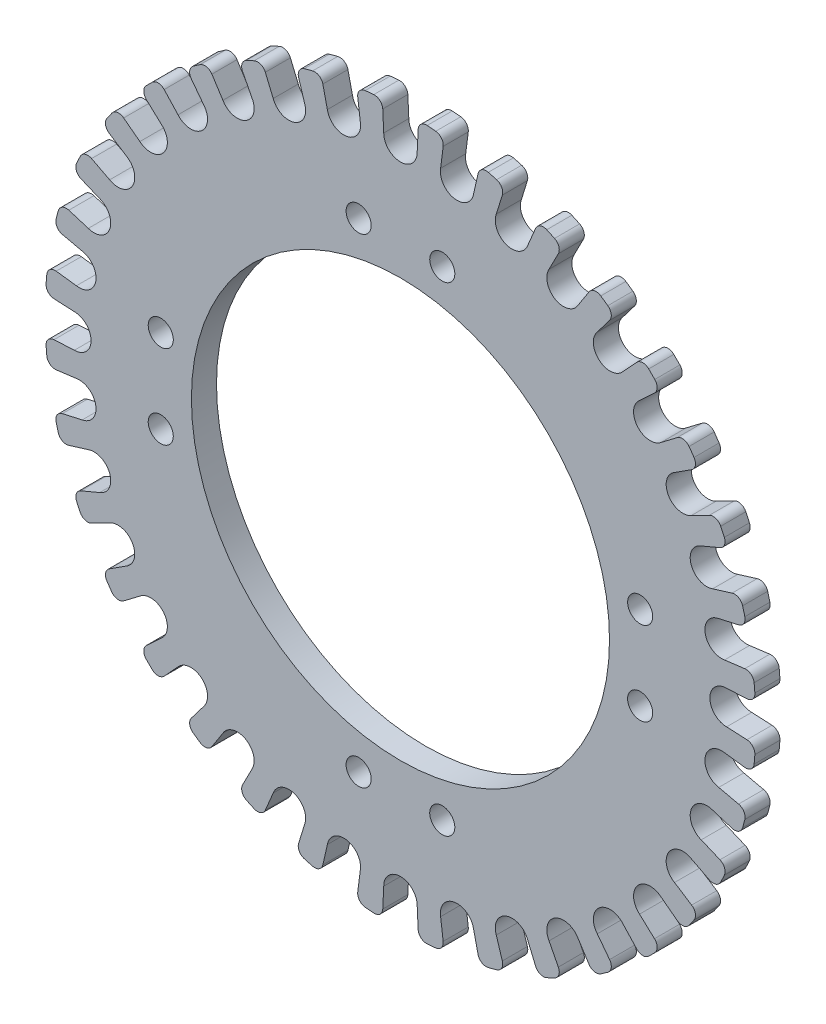
from build123d import *

# Parameters (mm, degrees)
SKETCH1_R                = 42.5
SKETCH1_R_2              = 25
SKETCH1_R_3              = 1.5
BOSS_EXTRUDE1_DEPTH      = 3
CUT_EXTRUDE1_DEPTH       = 61.178899957
FILLET1_R                = 1
CIRPATTERN1_COUNT        = 36
FILLET1_OF_CIRPATTERN1_R = 1


with BuildPart() as part:
    # Sketch1 → Boss-Extrude1 (new body)
    with BuildSketch(Plane.XY):
        Circle(SKETCH1_R)
        Circle(SKETCH1_R_2, mode=Mode.SUBTRACT)
        with Locations((-5, 28.665374196)):
            Circle(SKETCH1_R_3, mode=Mode.SUBTRACT)
        with Locations((5, 28.665374196)):
            Circle(SKETCH1_R_3, mode=Mode.SUBTRACT)
        with Locations((28.665374196, 5)):
            Circle(SKETCH1_R_3, mode=Mode.SUBTRACT)
        with Locations((28.665374196, -5)):
            Circle(SKETCH1_R_3, mode=Mode.SUBTRACT)
        with Locations((5, -28.665374196)):
            Circle(SKETCH1_R_3, mode=Mode.SUBTRACT)
        with Locations((-5, -28.665374196)):
            Circle(SKETCH1_R_3, mode=Mode.SUBTRACT)
        with Locations((-28.665374196, -5)):
            Circle(SKETCH1_R_3, mode=Mode.SUBTRACT)
        with Locations((-28.665374196, 5)):
            Circle(SKETCH1_R_3, mode=Mode.SUBTRACT)
    extrude(amount=BOSS_EXTRUDE1_DEPTH)

    # Sketch2 → Cut-Extrude1 (cut, through all)
    with BuildSketch(Plane.XY.offset(3)):
        with BuildLine():
            Line((-2, 39), (-2.25, 44.151660968))
            Line((-2.25, 44.151660968), (2.25, 44.151660968))
            Line((2.25, 44.151660968), (2, 39))
            ThreePointArc((2, 39), (0, 37), (-2, 39))
        make_face()
    cut_extrude1 = extrude(amount=-CUT_EXTRUDE1_DEPTH, mode=Mode.SUBTRACT)

    # Fillet1
    fillet1_edges = [part.edges().sort_by_distance(p)[0] for p in [
        (-2.167165012, 42.444709868, 1.5),
        (2.167165012, 42.444709868, 1.5),
    ]]
    fillet(fillet1_edges, radius=FILLET1_R)

    # CirPattern1: Cut-Extrude1 ×36 about axis
    cirpattern1_axis = Axis((0, 0, 3), (0, 0, -1))
    for i in range(1, CIRPATTERN1_COUNT):
        add(cut_extrude1.rotate(cirpattern1_axis, i * 360 / CIRPATTERN1_COUNT), mode=Mode.SUBTRACT)

    # Fillet1 of CirPattern1
    fillet1_of_cirpattern1_edges = [part.edges().sort_by_distance(p)[0] for p in [
        (5.236205614, 42.176203608, 1.5),
        (9.504687426, 41.423555098, 1.5),
        (12.480476783, 40.626194743, 1.5),
        (16.553414722, 39.143766567, 1.5),
        (19.34553498, 37.841779508, 1.5),
        (23.099174889, 35.674614496, 1.5),
        (25.622788885, 33.907560952, 1.5),
        (28.943078315, 31.121507317, 1.5),
        (31.121507317, 28.943078315, 1.5),
        (33.907560952, 25.622788885, 1.5),
        (35.674614496, 23.099174889, 1.5),
        (37.841779508, 19.34553498, 1.5),
        (39.143766567, 16.553414722, 1.5),
        (40.626194743, 12.480476783, 1.5),
        (41.423555098, 9.504687426, 1.5),
        (42.176203608, 5.236205614, 1.5),
        (42.444709868, 2.167165012, 1.5),
        (42.444709868, -2.167165012, 1.5),
        (42.176203608, -5.236205614, 1.5),
        (41.423555098, -9.504687426, 1.5),
        (40.626194743, -12.480476783, 1.5),
        (39.143766567, -16.553414722, 1.5),
        (37.841779508, -19.34553498, 1.5),
        (35.674614496, -23.099174889, 1.5),
        (33.907560952, -25.622788885, 1.5),
        (31.121507317, -28.943078315, 1.5),
        (28.943078315, -31.121507317, 1.5),
        (25.622788885, -33.907560952, 1.5),
        (23.099174889, -35.674614496, 1.5),
        (19.34553498, -37.841779508, 1.5),
        (16.553414722, -39.143766567, 1.5),
        (12.480476783, -40.626194743, 1.5),
        (9.504687426, -41.423555098, 1.5),
        (5.236205614, -42.176203608, 1.5),
        (2.167165012, -42.444709868, 1.5),
        (-2.167165012, -42.444709868, 1.5),
        (-5.236205614, -42.176203608, 1.5),
        (-9.504687426, -41.423555098, 1.5),
        (-12.480476783, -40.626194743, 1.5),
        (-16.553414722, -39.143766567, 1.5),
        (-19.34553498, -37.841779508, 1.5),
        (-23.099174889, -35.674614496, 1.5),
        (-25.622788885, -33.907560952, 1.5),
        (-28.943078315, -31.121507317, 1.5),
        (-31.121507317, -28.943078315, 1.5),
        (-33.907560952, -25.622788885, 1.5),
        (-35.674614496, -23.099174889, 1.5),
        (-37.841779508, -19.34553498, 1.5),
        (-39.143766567, -16.553414722, 1.5),
        (-40.626194743, -12.480476783, 1.5),
        (-41.423555098, -9.504687426, 1.5),
        (-42.176203608, -5.236205614, 1.5),
        (-42.444709868, -2.167165012, 1.5),
        (-42.444709868, 2.167165012, 1.5),
        (-42.176203608, 5.236205614, 1.5),
        (-41.423555098, 9.504687426, 1.5),
        (-40.626194743, 12.480476783, 1.5),
        (-39.143766567, 16.553414722, 1.5),
        (-37.841779508, 19.34553498, 1.5),
        (-35.674614496, 23.099174889, 1.5),
        (-33.907560952, 25.622788885, 1.5),
        (-31.121507317, 28.943078315, 1.5),
        (-28.943078315, 31.121507317, 1.5),
        (-25.622788885, 33.907560952, 1.5),
        (-23.099174889, 35.674614496, 1.5),
        (-19.34553498, 37.841779508, 1.5),
        (-16.553414722, 39.143766567, 1.5),
        (-12.480476783, 40.626194743, 1.5),
        (-9.504687426, 41.423555098, 1.5),
        (-5.236205614, 42.176203608, 1.5),
    ]]
    fillet(fillet1_of_cirpattern1_edges, radius=FILLET1_OF_CIRPATTERN1_R)


solid = part.part
